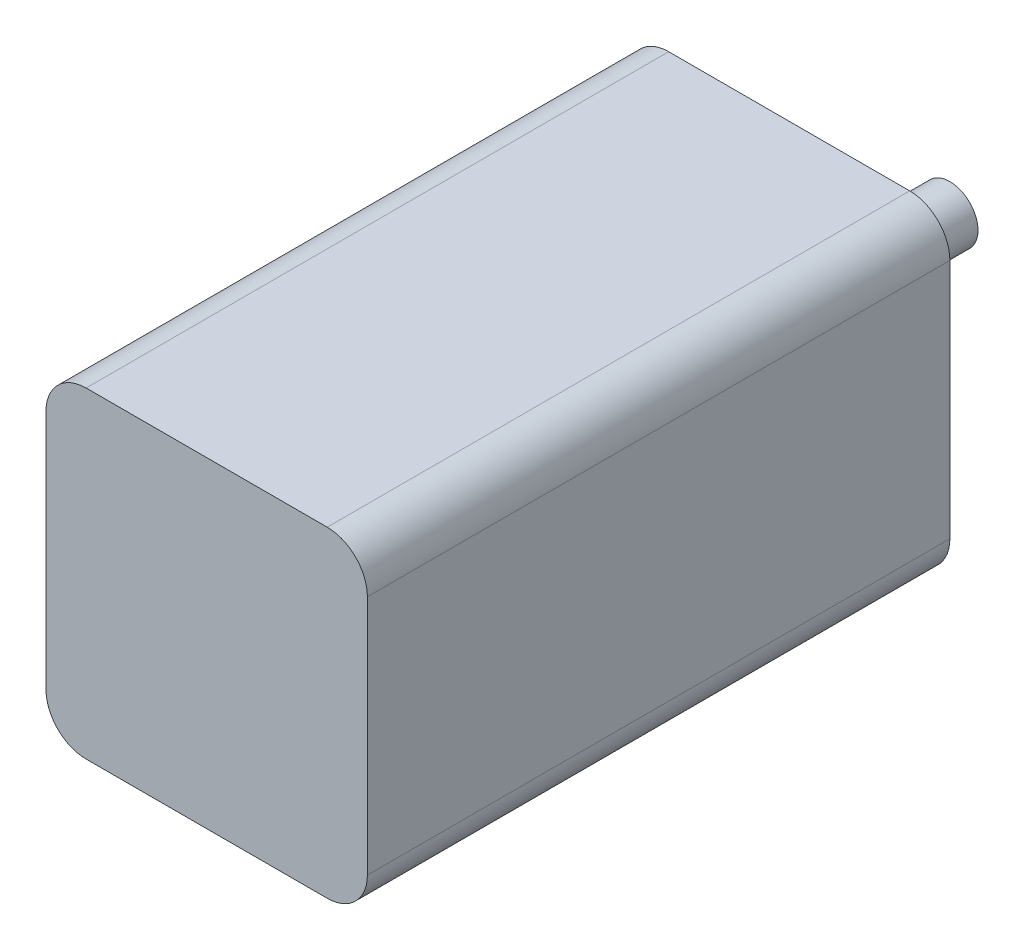
from build123d import *

# Parameters (mm, degrees)
SKETCH_1_W      = 80
SKETCH_1_H      = 80
EXTRUDE_1_DEPTH = 145
FILLET_1_R      = 10
SKETCH_2_R      = 7
EXTRUDE_2_DEPTH = 40


with BuildPart() as part:
    # Эскиз1 → Бобышка-Вытянуть1 (new body)
    with BuildSketch(Plane.XY):
        with Locations((-16.484717947, -21.221052632)):
            Rectangle(SKETCH_1_W, SKETCH_1_H)
    extrude(amount=EXTRUDE_1_DEPTH)

    # Скругление1
    fillet_1_edges = [part.edges().sort_by_distance(p)[0] for p in [
        (-56.484717947, -61.221052632, 72.5),
        (23.515282053, -61.221052632, 72.5),
        (-56.484717947, 18.778947368, 72.5),
        (23.515282053, 18.778947368, 72.5),
    ]]
    fillet(fillet_1_edges, radius=FILLET_1_R)

    # Эскиз2 → Бобышка-Вытянуть2 (add)
    with BuildSketch(Plane(origin=(0, 0, 0), x_dir=(-1, 0, 0), z_dir=(0, 0, -1))):
        with Locations((16.484717947, -21.221052632)):
            Circle(SKETCH_2_R)
    extrude(amount=EXTRUDE_2_DEPTH)


solid = part.part
